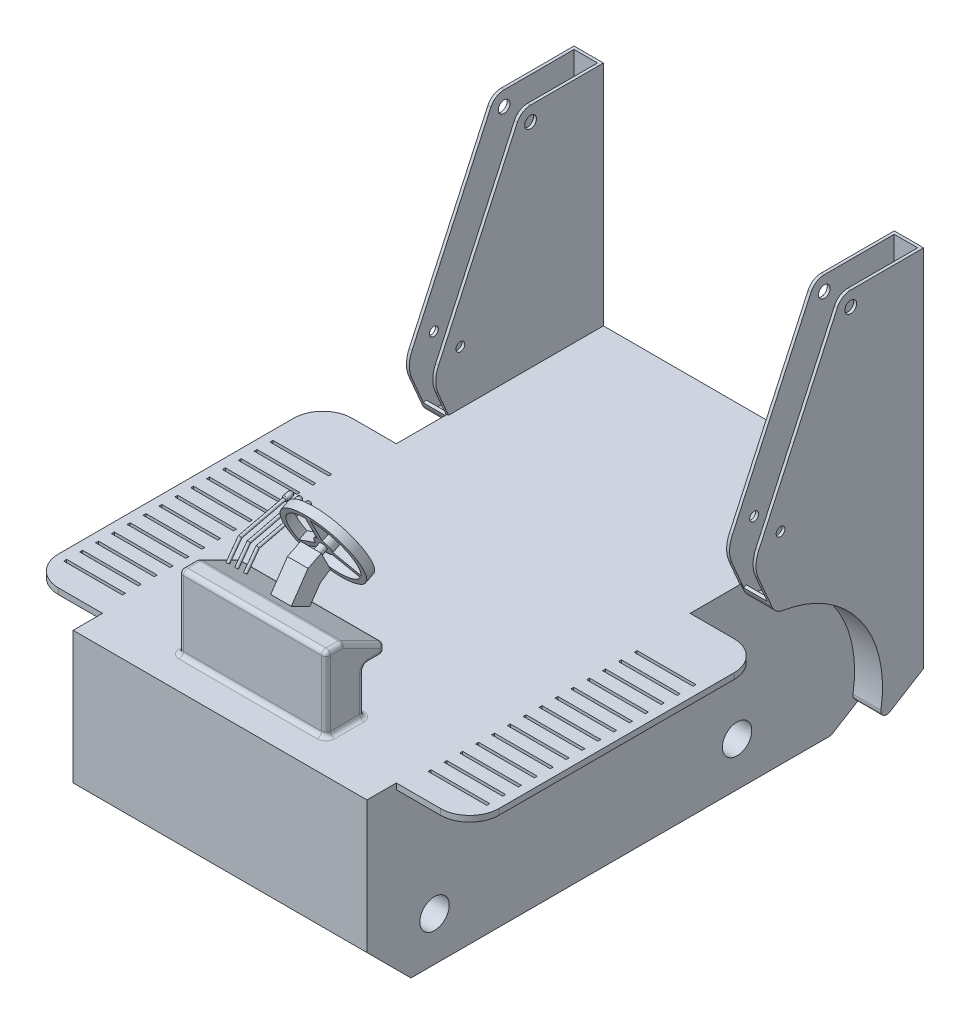
from build123d import *

# Parameters (mm, degrees)
SZKIC1_R                     = 50
DODANIE_WYCI_GNI_CIE1_DEPTH  = 500
DODANIE_WYCI_GNI_CIE2_DEPTH  = 5
DODANIE_WYCI_GNI_CIE3_DEPTH  = 80
DODANIE_WYCI_GNI_CIE5_START  = 90
DODANIE_WYCI_GNI_CIE5_DEPTH  = 5
SZKIC5_R                     = 20
SZKIC5_R_2                   = 15
WYTNIJ_WYCI_GNI_CIE1_DEPTH   = 2086.807286048
DODANIE_WYCI_GNI_CIE6_DEPTH  = 20
SZKIC7_W                     = 200
SZKIC7_H                     = 10
WYTNIJ_WYCI_GNI_CIE2_DEPTH   = 1486.594841985
SZYK_LINIOWY1_COUNT          = 14
SZYK_LINIOWY1_PITCH          = 54
SZKIC9_W                     = 500
SZKIC9_H                     = 200
DODANIE_WYCI_GNI_CIE7_DEPTH  = 253
SZKIC10_W                    = 70
SZKIC10_H                    = 150
WYTNIJ_WYCI_GNI_CIE3_DEPTH   = 1984.555402436
ZAOKR_GLENIE2_R              = 15
SZKIC12_R                    = 5
SZKIC13_R                    = 8.5
DODANIE_WYCI_GNI_CIE8_DEPTH  = 30
ZAOKR_GLENIE3_R              = 8.5
ZAOKR_GLENIE4_R              = 3.5
SZYK_LINIOWY2_COUNT          = 3
SZYK_LINIOWY2_PITCH          = 30
DODANIE_WYCI_GNI_CIE9_DEPTH  = 35
SZKIC16_R                    = 12.5
DODANIE_WYCI_GNI_CIE10_DEPTH = 30
SZKIC17_R                    = 135
SZKIC17_R_2                  = 12.5
DODANIE_WYCI_GNI_CIE11_DEPTH = 30


with BuildPart() as part:
    # Szkic1 → Dodanie-wyciągnięcie1 (new, symmetric)
    with BuildSketch(Plane(origin=(0, 0, 0), x_dir=(0, 0, -1), z_dir=(1, 0, 0))):
        Polygon((-778.301886792, 600), (1021.698113208, 600), (1021.698113208, 135), (801.698113208, 0), (-628.301886792, 0), (-778.301886792, 150), align=None)
        with Locations((-548.301886792, 150)):
            Circle(SZKIC1_R, mode=Mode.SUBTRACT)
        with Locations((481.698113208, 150)):
            Circle(SZKIC1_R, mode=Mode.SUBTRACT)
    extrude(amount=DODANIE_WYCI_GNI_CIE1_DEPTH, both=True)

    # Szkic6 → Dodanie-wyciągnięcie6 (add)
    with BuildSketch(Plane(origin=(0, 600, 0), x_dir=(1, 0, 0), z_dir=(0, 1, 0))):
        with BuildLine():
            Line((500, 321.698113208), (650, 321.698113208))
            ThreePointArc((650, 321.698113208), (720.710678119, 292.408791326), (750, 221.698113208))
            Line((750, 221.698113208), (750, -578.301886792))
            ThreePointArc((750, -578.301886792), (720.710678119, -649.012564911), (650, -678.301886792))
            Line((650, -678.301886792), (500, -678.301886792))
            Line((500, -678.301886792), (500, 321.698113208))
        make_face()
        with BuildLine():
            Line((-750, 221.698113208), (-750, -578.301886792))
            ThreePointArc((-750, -578.301886792), (-720.710678119, -649.012564911), (-650, -678.301886792))
            Line((-650, -678.301886792), (-500, -678.301886792))
            Line((-500, -678.301886792), (-500, 321.698113208))
            Line((-500, 321.698113208), (-650, 321.698113208))
            ThreePointArc((-650, 321.698113208), (-720.710678119, 292.408791326), (-750, 221.698113208))
        make_face()
    extrude(amount=-DODANIE_WYCI_GNI_CIE6_DEPTH)

    # Szkic7 → Wytnij-wyciągnięcie2 (cut, through all)
    with BuildSketch(Plane(origin=(0, 600, 0), x_dir=(1, 0, 0), z_dir=(0, 1, 0))):
        with Locations((620, 116.698113208)):
            Rectangle(SZKIC7_W, SZKIC7_H)
        with Locations((-620, 116.698113208)):
            Rectangle(SZKIC7_W, SZKIC7_H)
    wytnij_wyci_gni_cie2 = extrude(amount=-WYTNIJ_WYCI_GNI_CIE2_DEPTH, mode=Mode.SUBTRACT)

    # Szyk liniowy1: Wytnij-wyciągnięcie2 ×14
    with Locations(*[(0, 0, i * SZYK_LINIOWY1_PITCH) for i in range(1, SZYK_LINIOWY1_COUNT)]):
        add(wytnij_wyci_gni_cie2, mode=Mode.SUBTRACT)

    # Szkic9 → Dodanie-wyciągnięcie7 (add)
    with BuildSketch(Plane(origin=(0, 600, 0), x_dir=(1, 0, 0), z_dir=(0, 1, 0))):
        with Locations((0, -568.003609828)):
            Rectangle(SZKIC9_W, SZKIC9_H)
    extrude(amount=DODANIE_WYCI_GNI_CIE7_DEPTH)

    # Szkic10 → Wytnij-wyciągnięcie3 (cut, through all)
    with BuildSketch(Plane(origin=(250, 0, 0), x_dir=(0, 0, -1), z_dir=(1, 0, 0))):
        Polygon((-468.003609828, 853), (-608.003609828, 853), (-468.003609828, 783), align=None)
        with Locations((-503.003609828, 675)):
            Rectangle(SZKIC10_W, SZKIC10_H)
    extrude(amount=-WYTNIJ_WYCI_GNI_CIE3_DEPTH, mode=Mode.SUBTRACT)

    # Zaokrąglenie2
    zaokr_glenie2_edges = [part.edges().sort_by_distance(p)[0] for p in [
        (0, 600, 668.003609828),
        (-250, 726.5, 668.003609828),
        (250, 600, 603.003609828),
        (250, 726.5, 668.003609828),
        (0, 853, 668.003609828),
        (250, 853, 638.003609828),
        (-250, 853, 638.003609828),
        (0, 853, 608.003609828),
        (-250, 766.5, 468.003609828),
        (250, 766.5, 468.003609828),
        (0, 750, 468.003609828),
        (-250, 600, 603.003609828),
        (-250, 818, 538.003609828),
        (0, 783, 468.003609828),
        (250, 818, 538.003609828),
        (-250, 675, 538.003609828),
        (0, 600, 538.003609828),
        (-250, 750, 503.003609828),
        (0, 750, 538.003609828),
        (250, 750, 503.003609828),
        (250, 675, 538.003609828),
    ]]
    fillet(zaokr_glenie2_edges, radius=ZAOKR_GLENIE2_R)

    # Szkic15 → Dodanie-wyciągnięcie9 (add, symmetric)
    with BuildSketch(Plane(origin=(0, 0, 0), x_dir=(0, 0, -1), z_dir=(1, 0, 0))):
        Polygon((-570.836425558, 834.416407865), (-513.762846941, 917.744714123), (-469.051935492, 940.126277906), (-437.717746196, 877.531001877), (-472.542881638, 854.051317015), (-507.635299557, 802.815844865), align=None)
    extrude(amount=DODANIE_WYCI_GNI_CIE9_DEPTH, both=True)

    # Szkic16 → Dodanie-wyciągnięcie10 (add)
    with BuildSketch(Plane(origin=(0, 0.624505609, -1.247554249), x_dir=(-1, 0, 0), z_dir=(0, 0.44763127565276456, -0.8942182289897018))):
        with Locations(Location((0, 1015.640371487, 0), (0, 0, 90))):
            Circle(SZKIC16_R)
    extrude(amount=DODANIE_WYCI_GNI_CIE10_DEPTH)


with BuildPart() as body_2:
    # Szkic2 → Dodanie-wyciągnięcie2 (new, symmetric)
    with BuildSketch(Plane(origin=(500, 0, 0), x_dir=(0, 0, -1), z_dir=(1, 0, 0))):
        with BuildLine():
            Line((1021.698113208, 135), (1021.698113208, 600))
            Line((1021.698113208, 600), (1021.698113208, 1375))
            Line((1021.698113208, 1375), (773.721323232, 1375))
            ThreePointArc((773.721323232, 1375), (746.754774222, 1367.104693735), (728.304591746, 1345.912209381))
            Line((728.304591746, 1345.912209381), (460.285606408, 763.833765708))
            ThreePointArc((460.285606408, 763.833765708), (451.127926833, 723.340291143), (459.204566377, 682.617417089))
            Line((459.204566377, 682.617417089), (505.376238548, 574.883515358))
            ThreePointArc((505.376238548, 574.883515358), (520.652489164, 555.099407026), (543.596225955, 545.181760255))
            ThreePointArc((543.596225955, 545.181760255), (805.934443537, 384.245175178), (876.32085296, 84.632628396))
            ThreePointArc((876.32085296, 84.632628396), (884.886865611, 64.770887689), (906.512314345, 64.317805243))
            Line((906.512314345, 64.317805243), (1021.698113208, 135))
        make_face()
    extrude(amount=DODANIE_WYCI_GNI_CIE2_DEPTH, both=True)

    # Szkic3 → Dodanie-wyciągnięcie3 (add)
    with BuildSketch(Plane(origin=(505, 0, 0), x_dir=(0, 0, -1), z_dir=(1, 0, 0))):
        with BuildLine():
            Line((1021.698113208, 135), (1021.698113208, 1375))
            Line((1021.698113208, 1375), (1011.698113208, 1375))
            Line((1011.698113208, 1375), (1011.698113208, 140.596281363))
            Line((1011.698113208, 140.596281363), (901.282152146, 72.84103253))
            ThreePointArc((901.282152146, 72.84103253), (890.469427779, 73.067573753), (886.186421454, 82.998444106))
            ThreePointArc((886.186421454, 82.998444106), (814.040351796, 390.101304558), (545.143678774, 555.061304261))
            ThreePointArc((545.143678774, 555.061304261), (526.788689341, 562.995421678), (514.567688848, 578.822708344))
            Line((514.567688848, 578.822708344), (508.517766858, 592.939192986))
            Line((508.517766858, 592.939192986), (499.326316558, 589))
            Line((499.326316558, 589), (505.376238548, 574.883515358))
            ThreePointArc((505.376238548, 574.883515358), (520.652489164, 555.099407026), (543.596225955, 545.181760255))
            ThreePointArc((543.596225955, 545.181760255), (805.934443537, 384.245175178), (876.32085296, 84.632628396))
            ThreePointArc((876.32085296, 84.632628396), (884.886865611, 64.770887689), (906.512314345, 64.317805243))
            Line((906.512314345, 64.317805243), (1021.698113208, 135))
        make_face()
    extrude(amount=DODANIE_WYCI_GNI_CIE3_DEPTH)

    # Szkic2<4> → Dodanie-wyciągnięcie5 (add, symmetric)
    with BuildSketch(Plane(origin=(500, 0, 0), x_dir=(0, 0, -1), z_dir=(1, 0, 0)).offset(DODANIE_WYCI_GNI_CIE5_START)):
        with BuildLine():
            Line((1021.698113208, 135), (1021.698113208, 600))
            Line((1021.698113208, 600), (1021.698113208, 1375))
            Line((1021.698113208, 1375), (773.721323232, 1375))
            ThreePointArc((773.721323232, 1375), (746.754774222, 1367.104693735), (728.304591746, 1345.912209381))
            Line((728.304591746, 1345.912209381), (460.285606408, 763.833765708))
            ThreePointArc((460.285606408, 763.833765708), (451.127926833, 723.340291143), (459.204566377, 682.617417089))
            Line((459.204566377, 682.617417089), (505.376238548, 574.883515358))
            ThreePointArc((505.376238548, 574.883515358), (520.652489164, 555.099407026), (543.596225955, 545.181760255))
            ThreePointArc((543.596225955, 545.181760255), (805.934443537, 384.245175178), (876.32085296, 84.632628396))
            ThreePointArc((876.32085296, 84.632628396), (884.886865611, 64.770887689), (906.512314345, 64.317805243))
            Line((906.512314345, 64.317805243), (1021.698113208, 135))
        make_face()
    extrude(amount=DODANIE_WYCI_GNI_CIE5_DEPTH, both=True)


with BuildPart() as body_3:
    # Lustro1: mirrored copy
    add(body_2.part.mirror(Plane(origin=(0, 0, 0), x_dir=(0, 0, 1), z_dir=(1, 0, 0))))


with BuildPart() as wytnij_wyci_gni_cie1_tool:
    # Szkic5 → Wytnij-wyciągnięcie1 (new, through all)
    with BuildSketch(Plane(origin=(595, 0, 0), x_dir=(0, 0, -1), z_dir=(1, 0, 0))):
        with Locations((773.721323232, 1325)):
            Circle(SZKIC5_R)
        with Locations((534.709534549, 782.009346947)):
            Circle(SZKIC5_R_2)
    extrude(amount=-WYTNIJ_WYCI_GNI_CIE1_DEPTH)


with BuildPart() as body_2_1:
    add(body_2.part)

    # Wytnij-wyciągnięcie1: cut by wytnij_wyci_gni_cie1_tool
    add(wytnij_wyci_gni_cie1_tool.part, mode=Mode.SUBTRACT)


with BuildPart() as body_3_1:
    add(body_3.part)

    # Wytnij-wyciągnięcie1: cut by wytnij_wyci_gni_cie1_tool
    add(wytnij_wyci_gni_cie1_tool.part, mode=Mode.SUBTRACT)


with BuildPart() as body_4:
    # Wyciągnięcie po ścieżce1: sweep along a path in Szkic11
    with BuildLine(Plane.ZY.offset(220)) as wyci_gni_cie_po_cie_ce1_path:
        Line((531.544629491, 814.770509831), (489.843174739, 870.993180273))
        Line((489.843174739, 870.993180273), (339.843174739, 906.824923632))
    # Szkic12 → Wyciągnięcie po ścieżce1 (sweep)
    with BuildSketch(Plane(origin=(-220, 906.824923632, 339.843174739), x_dir=(-1, 0, 0), z_dir=(0, 0.2323412264214768, -0.9726343375107441))):
        with Locations((0.072965505, 0.194123298)):
            Circle(SZKIC12_R)
    sweep(path=wyci_gni_cie_po_cie_ce1_path.line, transition=Transition.RIGHT)

    # Szkic13 → Dodanie-wyciągnięcie8 (add)
    with BuildSketch(Plane(origin=(0, -27.84617178, 116.570542638), x_dir=(-1, 0, 0), z_dir=(0, 0.23234122642147678, -0.9726343375107441))):
        with Locations(Location((220.072965505, 961.162762143, 0), (0, 0, 90))):
            Circle(SZKIC13_R)
    extrude(amount=DODANIE_WYCI_GNI_CIE8_DEPTH)

    # Zaokrąglenie3
    zaokr_glenie3_edges = [body_4.edges().sort_by_distance(p)[0] for p in [
        (-220.072965505, 905.716579541, 308.734347035),
    ]]
    fillet(zaokr_glenie3_edges, radius=ZAOKR_GLENIE3_R)

    # Zaokrąglenie4
    zaokr_glenie4_edges = [body_4.edges().sort_by_distance(p)[0] for p in [
        (-220.072965505, 898.746342748, 337.91337716),
    ]]
    fillet(zaokr_glenie4_edges, radius=ZAOKR_GLENIE4_R - 0.0001)  # a hair under: the kernel refuses the full size


with BuildPart() as szyk_liniowy2_1:
    # Szyk liniowy2: pattern copy
    add(body_4.part.moved(Location(Vector(1, 0, 0) * (1 * SZYK_LINIOWY2_PITCH))))


with BuildPart() as szyk_liniowy2_2:
    # Szyk liniowy2: pattern copy
    add(body_4.part.moved(Location(Vector(1, 0, 0) * (2 * SZYK_LINIOWY2_PITCH))))


with BuildPart() as body_7:
    # Szkic17 → Dodanie-wyciągnięcie11 (new body)
    with BuildSketch(Plane(origin=(0, 14.053443879, -28.074101119), x_dir=(-1, 0, 0), z_dir=(0, 0.44763127565276456, -0.8942182289897018))):
        with Locations(Location((0, 1015.640371487, 0), (0, 0, 270))):
            Circle(SZKIC17_R)
        with BuildLine():
            Line((20.32820637, 993.577642151), (96.557169881, 949.566829547))
            ThreePointArc((96.557169881, 949.566829547), (0, 898.640371487), (-96.557169881, 949.566829547))
            Line((-96.557169881, 949.566829547), (-20.32820637, 993.577642151))
            ThreePointArc((-20.32820637, 993.577642151), (0, 985.640371487), (20.32820637, 993.577642151))
        make_face(mode=Mode.SUBTRACT)
        with BuildLine():
            ThreePointArc((-105.549523656, 965.159701366), (-101.310621637, 1074.165220428), (-9, 1132.293704059))
            Line((-9, 1132.293704059), (-9, 1044.25854753))
            ThreePointArc((-9, 1044.25854753), (-25.965748919, 1030.666345103), (-29.297038783, 1009.184094034))
            Line((-29.297038783, 1009.184094034), (-105.549523656, 965.159701366))
        make_face(mode=Mode.SUBTRACT)
        with Locations(Location((0, 1015.640371487, 0), (0, 0, 270))):
            Circle(SZKIC17_R_2, mode=Mode.SUBTRACT)
        with BuildLine():
            Line((9, 1044.25854753), (9, 1132.293704059))
            ThreePointArc((9, 1132.293704059), (101.310621637, 1074.165220428), (105.549523656, 965.159701366))
            Line((105.549523656, 965.159701366), (29.297038783, 1009.184094034))
            ThreePointArc((29.297038783, 1009.184094034), (25.965748919, 1030.666345103), (9, 1044.25854753))
        make_face(mode=Mode.SUBTRACT)
    extrude(amount=DODANIE_WYCI_GNI_CIE11_DEPTH)


solid = Compound([part.part, body_2_1.part, body_3_1.part, body_4.part, szyk_liniowy2_1.part, szyk_liniowy2_2.part, body_7.part])
